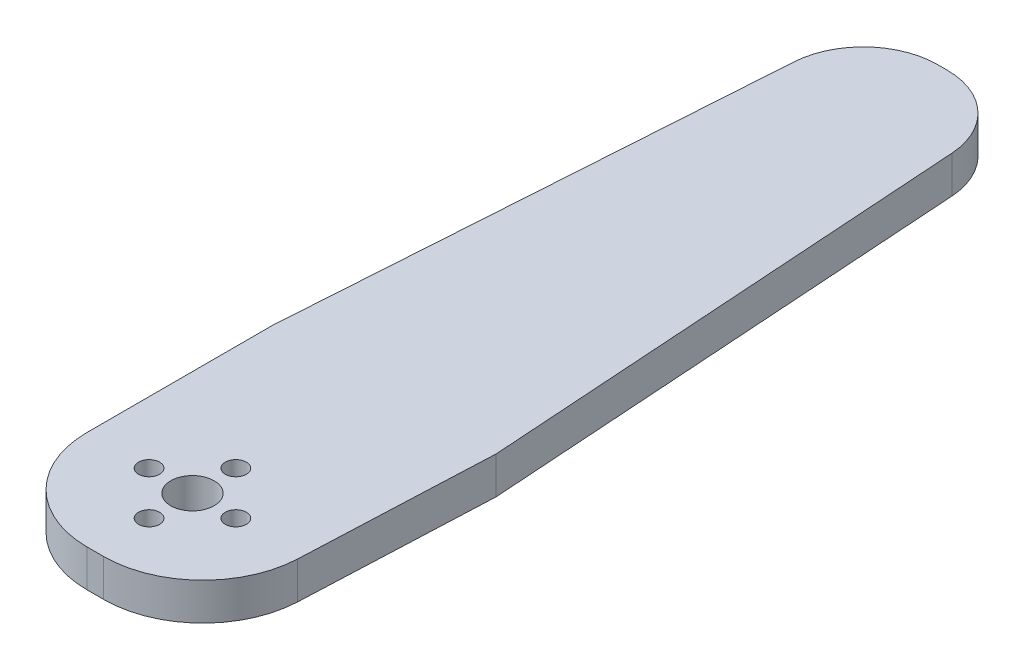
from build123d import *

# Parameters (mm, degrees)
BOSS_1_DEPTH  = 6
S_CYL2_R      = 12.5
BOSS_2_DEPTH  = 2
S_HOLE3_R     = 3.5
HOLE_3_DEPTH  = 8.2
S_HOLE4_R     = 1.7
HOLE_4_DEPTH  = 8.2
S_HOLE5_R     = 1.7
HOLE_5_DEPTH  = 8.2
S_HOLE6_R     = 1.7
HOLE_6_DEPTH  = 8.2
S_HOLE7_R     = 1.7
HOLE_7_DEPTH  = 8.2
S_HOLE8_R     = 3.2
HOLE_8_DEPTH  = 5.1
S_HOLE9_R     = 3.2
HOLE_9_DEPTH  = 5.1
S_HOLE10_R    = 3.2
HOLE_10_DEPTH = 5.1
S_HOLE11_R    = 3.2
HOLE_11_DEPTH = 5.1


with BuildPart() as part:
    # S_prism1 → Boss_1 (new body)
    with BuildSketch(Plane(origin=(0, -6, 0), x_dir=(1, 0, 0), z_dir=(0, 1, 0))):
        with BuildLine():
            Line((-1, -16), (1.6805, -16))
            ThreePointArc((1.6805, -16), (12.745771818, -11.556826983), (17.6654, -0.695))
            Line((17.6654, -0.695), (19, 30))
            Line((19, 30), (13.7468, 108.7982))
            ThreePointArc((13.7468, 108.7982), (9.971633889, 116.762968295), (1.7734, 120))
            Line((1.7734, 120), (0.2266, 120))
            ThreePointArc((0.2266, 120), (-7.971633889, 116.762968295), (-11.7468, 108.7982))
            Line((-11.7468, 108.7982), (-17, 30))
            Line((-17, 30), (-17, 0))
            ThreePointArc((-17, 0), (-12.3137, -11.3137), (-1, -16))
        make_face()
    extrude(amount=BOSS_1_DEPTH)

    # S_cyl2 → Boss_2 (add)
    with BuildSketch(Plane(origin=(0, -8, 0), x_dir=(1, 0, 0), z_dir=(0, 1, 0))):
        Circle(S_CYL2_R)
    extrude(amount=BOSS_2_DEPTH)

    # S_hole3 → Hole_3 (cut)
    with BuildSketch(Plane(origin=(0, -8.1, 0), x_dir=(1, 0, 0), z_dir=(0, 1, 0))):
        Circle(S_HOLE3_R)
    extrude(amount=HOLE_3_DEPTH, mode=Mode.SUBTRACT)

    # S_hole4 → Hole_4 (cut)
    with BuildSketch(Plane(origin=(0, -8.1, 0), x_dir=(1, 0, 0), z_dir=(0, 1, 0))):
        with Locations((7, 0)):
            Circle(S_HOLE4_R)
    extrude(amount=HOLE_4_DEPTH, mode=Mode.SUBTRACT)

    # S_hole5 → Hole_5 (cut)
    with BuildSketch(Plane(origin=(0, -8.1, 0), x_dir=(1, 0, 0), z_dir=(0, 1, 0))):
        with Locations((0, -7)):
            Circle(S_HOLE5_R)
    extrude(amount=HOLE_5_DEPTH, mode=Mode.SUBTRACT)

    # S_hole6 → Hole_6 (cut)
    with BuildSketch(Plane(origin=(0, -8.1, 0), x_dir=(1, 0, 0), z_dir=(0, 1, 0))):
        with Locations((-7, 0)):
            Circle(S_HOLE6_R)
    extrude(amount=HOLE_6_DEPTH, mode=Mode.SUBTRACT)

    # S_hole7 → Hole_7 (cut)
    with BuildSketch(Plane(origin=(0, -8.1, 0), x_dir=(1, 0, 0), z_dir=(0, 1, 0))):
        with Locations((0, 7)):
            Circle(S_HOLE7_R)
    extrude(amount=HOLE_7_DEPTH, mode=Mode.SUBTRACT)

    # S_hole8 → Hole_8 (cut)
    with BuildSketch(Plane(origin=(0, -8.1, 0), x_dir=(1, 0, 0), z_dir=(0, 1, 0))):
        with Locations((7, 0)):
            Circle(S_HOLE8_R)
    extrude(amount=HOLE_8_DEPTH, mode=Mode.SUBTRACT)

    # S_hole9 → Hole_9 (cut)
    with BuildSketch(Plane(origin=(0, -8.1, 0), x_dir=(1, 0, 0), z_dir=(0, 1, 0))):
        with Locations((0, -7)):
            Circle(S_HOLE9_R)
    extrude(amount=HOLE_9_DEPTH, mode=Mode.SUBTRACT)

    # S_hole10 → Hole_10 (cut)
    with BuildSketch(Plane(origin=(0, -8.1, 0), x_dir=(1, 0, 0), z_dir=(0, 1, 0))):
        with Locations((-7, 0)):
            Circle(S_HOLE10_R)
    extrude(amount=HOLE_10_DEPTH, mode=Mode.SUBTRACT)

    # S_hole11 → Hole_11 (cut)
    with BuildSketch(Plane(origin=(0, -8.1, 0), x_dir=(1, 0, 0), z_dir=(0, 1, 0))):
        with Locations((0, 7)):
            Circle(S_HOLE11_R)
    extrude(amount=HOLE_11_DEPTH, mode=Mode.SUBTRACT)


solid = part.part
